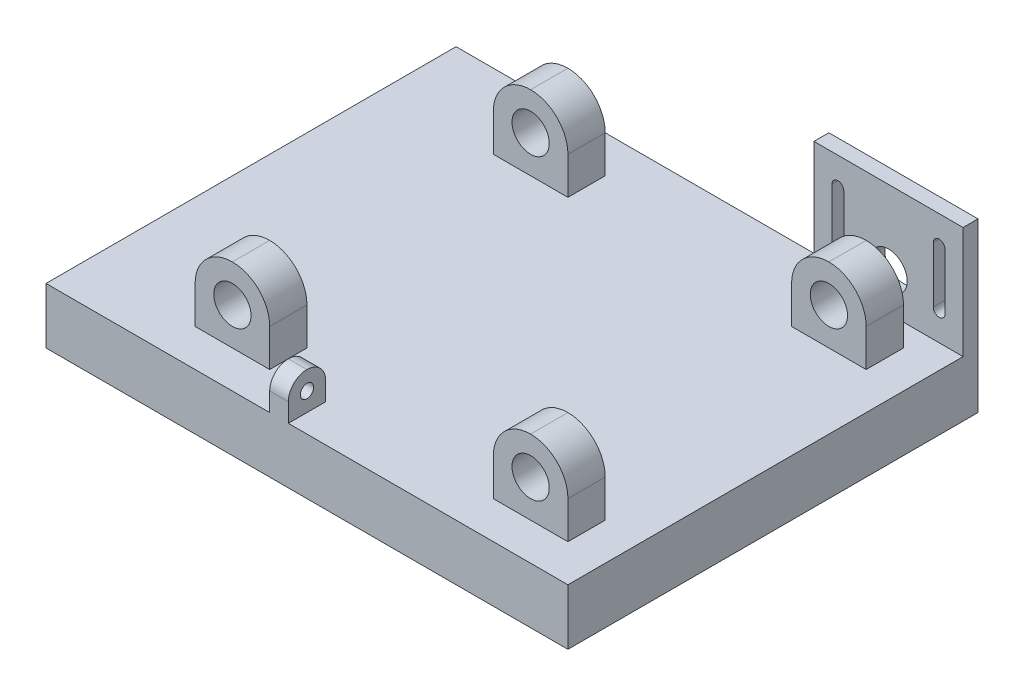
from build123d import *

# Parameters (mm, degrees)
SKETCH1_W               = 177.8
SKETCH1_H               = 139.7
BOSS_EXTRUDE1_DEPTH     = 19.05
SKETCH3_W               = 25.4
SKETCH3_H               = 12.7
BOSS_EXTRUDE2_DEPTH     = 25.4
SKETCH5_W               = 50.8
SKETCH5_H               = 5.08
BOSS_EXTRUDE3_DEPTH     = 38.1
CUT_EXTRUDE1_DEPTH      = 156.672163536
CUT_EXTRUDE1_DEPTH_BACK = 156.672163536
SKETCH4_R               = 6.35
CUT_EXTRUDE2_REACH      = 177.173
SKETCH7_W               = 6.35
SKETCH7_H               = 12.7
BOSS_EXTRUDE4_DEPTH     = 12.7
FILLET1_R               = 12.7
CUT_EXTRUDE3_REACH      = 133.216
SKETCH8_R               = 2.280315524
FILLET2_R               = 6.35


with BuildPart() as part:
    # Sketch1 → Boss-Extrude1 (new body)
    with BuildSketch(Plane(origin=(0, 0, 0), x_dir=(1, 0, 0), z_dir=(0, 1, 0))):
        Rectangle(SKETCH1_W, SKETCH1_H)
    extrude(amount=BOSS_EXTRUDE1_DEPTH)

    # Sketch3 → Boss-Extrude2 (add)
    with BuildSketch(Plane(origin=(0, 19.05, 0), x_dir=(1, 0, 0), z_dir=(0, 1, 0))):
        with Locations((-38.1, 50.8)):
            Rectangle(SKETCH3_W, SKETCH3_H)
        with Locations((63.5, 50.8)):
            Rectangle(SKETCH3_W, SKETCH3_H)
        with Locations((-38.1, -50.8)):
            Rectangle(SKETCH3_W, SKETCH3_H)
        with Locations((63.5, -50.8)):
            Rectangle(SKETCH3_W, SKETCH3_H)
    extrude(amount=BOSS_EXTRUDE2_DEPTH)

    # Sketch5 → Boss-Extrude3 (add)
    with BuildSketch(Plane(origin=(0, 19.05, 0), x_dir=(1, 0, 0), z_dir=(0, 1, 0))):
        with Locations((63.5, 67.31)):
            Rectangle(SKETCH5_W, SKETCH5_H)
    extrude(amount=BOSS_EXTRUDE3_DEPTH)

    # Sketch4 → Cut-Extrude1 (cut, two sides: drawn at the far end of the back side and taken through both)
    with BuildSketch(Plane(origin=(0, 0, 44.45), x_dir=(-1, 0, 0), z_dir=(0, 0, -1)).offset(-CUT_EXTRUDE1_DEPTH_BACK)):
        with Locations((38.1, 31.75)):
            Circle(SKETCH4_R)
        with Locations((-63.5, 31.75)):
            Circle(SKETCH4_R)
    extrude(amount=CUT_EXTRUDE1_DEPTH + CUT_EXTRUDE1_DEPTH_BACK, mode=Mode.SUBTRACT)

    # Sketch6 → Cut-Extrude2 (cut, up to next)
    with BuildSketch(Plane(origin=(0, 0, -69.85), x_dir=(-1, 0, 0), z_dir=(0, 0, -1)), mode=Mode.PRIVATE) as cut_extrude2_sk1:
        with BuildLine():
            Line((-48.25, 28.575), (-48.25, 47.625))
            ThreePointArc((-48.25, 47.625), (-46.25, 49.625), (-44.25, 47.625))
            Line((-44.25, 47.625), (-44.25, 28.575))
            ThreePointArc((-44.25, 28.575), (-46.25, 26.575), (-48.25, 28.575))
        make_face()
    cut_extrude2_tool1 = extrude(cut_extrude2_sk1.sketch, amount=-CUT_EXTRUDE2_REACH, mode=Mode.PRIVATE) & part.part
    # Sketch6 → Cut-Extrude2 (cut, up to next)
    with BuildSketch(Plane(origin=(0, 0, -69.85), x_dir=(-1, 0, 0), z_dir=(0, 0, -1)), mode=Mode.PRIVATE) as cut_extrude2_sk2:
        with BuildLine():
            Line((-82.75, 28.575), (-82.75, 47.625))
            ThreePointArc((-82.75, 47.625), (-80.75, 49.625), (-78.75, 47.625))
            Line((-78.75, 47.625), (-78.75, 28.575))
            ThreePointArc((-78.75, 28.575), (-80.75, 26.575), (-82.75, 28.575))
        make_face()
    cut_extrude2_tool2 = extrude(cut_extrude2_sk2.sketch, amount=-CUT_EXTRUDE2_REACH, mode=Mode.PRIVATE) & part.part
    add(cut_extrude2_tool1.solids().sort_by_distance((46.25, 38.1, -69.85))[0], mode=Mode.SUBTRACT)
    add(cut_extrude2_tool2.solids().sort_by_distance((80.75, 38.1, -69.85))[0], mode=Mode.SUBTRACT)

    # Sketch7 → Boss-Extrude4 (add)
    with BuildSketch(Plane(origin=(0, 19.05, 0), x_dir=(1, 0, 0), z_dir=(0, 1, 0))):
        with Locations((-9.525, -63.5)):
            Rectangle(SKETCH7_W, SKETCH7_H)
    extrude(amount=BOSS_EXTRUDE4_DEPTH)

    # Fillet1
    fillet1_edges = [part.edges().sort_by_distance(p)[0] for p in [
        (76.2, 44.45, -50.8),
        (50.8, 44.45, -50.8),
        (76.2, 44.45, 50.8),
        (50.8, 44.45, 50.8),
        (-25.4, 44.45, 50.8),
        (-50.8, 44.45, 50.8),
        (-25.4, 44.45, -50.8),
        (-50.8, 44.45, -50.8),
    ]]
    fillet(fillet1_edges, radius=FILLET1_R - 0.0001)  # a hair under: the kernel refuses the full size

    # Sketch8 → Cut-Extrude3 (cut, up to next)
    with BuildSketch(Plane(origin=(-6.35, 0, 0), x_dir=(0, 0, -1), z_dir=(1, 0, 0)), mode=Mode.PRIVATE) as cut_extrude3_sk1:
        with Locations((-63.5, 25.4)):
            Circle(SKETCH8_R)
    cut_extrude3_tool1 = extrude(cut_extrude3_sk1.sketch, amount=-CUT_EXTRUDE3_REACH, mode=Mode.PRIVATE) & part.part
    add(cut_extrude3_tool1.solids().sort_by_distance((-6.35, 25.4, 63.5))[0], mode=Mode.SUBTRACT)

    # Fillet2
    fillet2_edges = [part.edges().sort_by_distance(p)[0] for p in [
        (-9.525, 31.75, 57.15),
        (-9.525, 31.75, 69.85),
    ]]
    fillet(fillet2_edges, radius=FILLET2_R - 0.0001)  # a hair under: the kernel refuses the full size


solid = part.part
